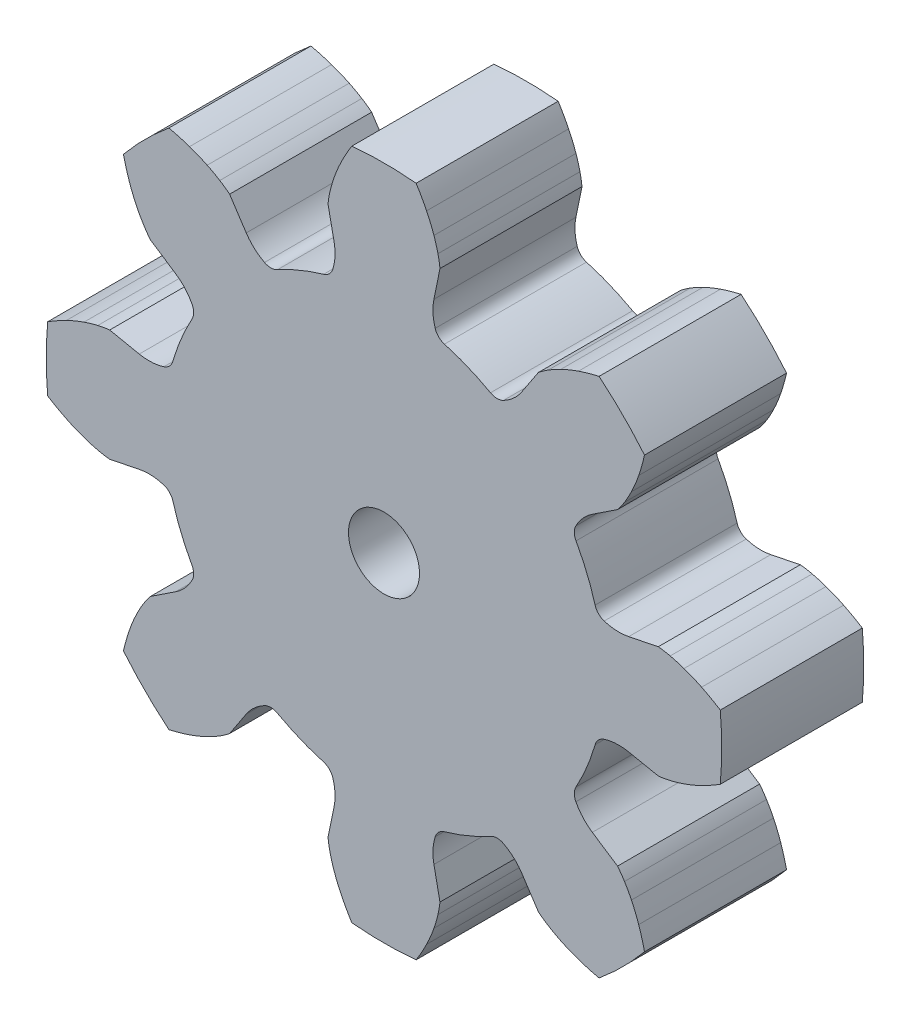
from build123d import *

# Parameters (mm, degrees)
BOSS_EXTRUDE1_DEPTH = 6.35
SKETCH2_R           = 1.5875
CUT_EXTRUDE1_DEPTH  = 23.284602263


with BuildPart() as part:
    # Model → Boss-Extrude1 (new body)
    with BuildSketch(Plane.XY):
        with BuildLine():
            Line((10.941748162, -2.232688974), (12.264436965, -2.502586677))
            ThreePointArc((12.264436965, -2.502586677), (12.531238017, -2.46596816), (12.795229484, -2.41274953))
            ThreePointArc((12.795229484, -2.41274953), (13.106430951, -2.331177744), (13.412940362, -2.233441923))
            ThreePointArc((13.412940362, -2.233441923), (13.811496383, -2.08104704), (14.200064035, -1.904734018))
            ThreePointArc((14.200064035, -1.904734018), (14.624278476, -1.682049743), (15.035831779, -1.436753888))
            ThreePointArc((15.035831779, -1.436753888), (15.104320541, 0), (15.035831779, 1.436753888))
            ThreePointArc((15.035831779, 1.436753888), (14.624278476, 1.682049743), (14.200064035, 1.904734018))
            ThreePointArc((14.200064035, 1.904734018), (13.811496383, 2.08104704), (13.412940362, 2.233441923))
            ThreePointArc((13.412940362, 2.233441923), (13.106430951, 2.331177744), (12.795229484, 2.41274953))
            ThreePointArc((12.795229484, 2.41274953), (12.531238017, 2.46596816), (12.264436965, 2.502586677))
            Line((12.264436965, 2.502586677), (10.941748216, 2.232688984))
            ThreePointArc((10.941748216, 2.232688984), (10.38941583, 2.191161038), (9.844221433, 2.288929667))
            ThreePointArc((9.844221433, 2.288929667), (9.58984879, 2.445145019), (9.439984515, 2.703310425))
            ThreePointArc((9.439984515, 2.703310425), (9.071969901, 3.757732961), (8.586606206, 4.763547917))
            ThreePointArc((8.586606206, 4.763547917), (8.510025734, 5.052068464), (8.579433412, 5.342398017))
            ThreePointArc((8.579433412, 5.342398017), (8.895811187, 5.797041528), (9.315733837, 6.15823481))
            Line((9.315733837, 6.15823481), (10.441862555, 6.902670535))
            ThreePointArc((10.441862555, 6.902670535), (10.604626186, 7.11722057), (10.753665089, 7.341521981))
            ThreePointArc((10.753665089, 7.341521981), (10.916037793, 7.619254612), (11.063663015, 7.905099156))
            ThreePointArc((11.063663015, 7.905099156), (11.237725225, 8.294680276), (11.387811912, 8.694111232))
            ThreePointArc((11.387811912, 8.694111232), (11.53031526, 9.1515377), (11.647877028, 9.616000194))
            ThreePointArc((11.647877028, 9.616000194), (10.68036748, 10.68036748), (9.616000194, 11.647877028))
            ThreePointArc((9.616000194, 11.647877028), (9.1515377, 11.53031526), (8.694111232, 11.387811912))
            ThreePointArc((8.694111232, 11.387811912), (8.294680276, 11.237725225), (7.905099156, 11.063663015))
            ThreePointArc((7.905099156, 11.063663015), (7.619254612, 10.916037793), (7.341521981, 10.753665089))
            ThreePointArc((7.341521981, 10.753665089), (7.11722057, 10.604626186), (6.902670535, 10.441862555))
            Line((6.902670535, 10.441862555), (6.15823484, 9.315733882))
            ThreePointArc((6.15823484, 9.315733882), (5.797041557, 8.895811214), (5.342398042, 8.57943342))
            ThreePointArc((5.342398042, 8.57943342), (5.052068486, 8.510025734), (4.763547932, 8.586606198))
            ThreePointArc((4.763547932, 8.586606198), (3.757732977, 9.071969895), (2.703310441, 9.43998451))
            ThreePointArc((2.703310441, 9.43998451), (2.445145035, 9.589848775), (2.288929678, 9.84422141))
            ThreePointArc((2.288929678, 9.84422141), (2.191161039, 10.38941579), (2.232688974, 10.941748162))
            Line((2.232688974, 10.941748162), (2.502586677, 12.264436965))
            ThreePointArc((2.502586677, 12.264436965), (2.46596816, 12.531238017), (2.41274953, 12.795229484))
            ThreePointArc((2.41274953, 12.795229484), (2.331177744, 13.106430951), (2.233441923, 13.412940362))
            ThreePointArc((2.233441923, 13.412940362), (2.08104704, 13.811496383), (1.904734018, 14.200064035))
            ThreePointArc((1.904734018, 14.200064035), (1.682049743, 14.624278476), (1.436753888, 15.035831779))
            ThreePointArc((1.436753888, 15.035831779), (0, 15.104320541), (-1.436753888, 15.035831779))
            ThreePointArc((-1.436753888, 15.035831779), (-1.682049743, 14.624278476), (-1.904734018, 14.200064035))
            ThreePointArc((-1.904734018, 14.200064035), (-2.08104704, 13.811496383), (-2.233441923, 13.412940362))
            ThreePointArc((-2.233441923, 13.412940362), (-2.331177744, 13.106430951), (-2.41274953, 12.795229484))
            ThreePointArc((-2.41274953, 12.795229484), (-2.46596816, 12.531238017), (-2.502586677, 12.264436965))
            Line((-2.502586677, 12.264436965), (-2.232688984, 10.941748216))
            ThreePointArc((-2.232688984, 10.941748216), (-2.191161038, 10.38941583), (-2.288929667, 9.844221433))
            ThreePointArc((-2.288929667, 9.844221433), (-2.445145019, 9.58984879), (-2.703310425, 9.439984515))
            ThreePointArc((-2.703310425, 9.439984515), (-3.757732961, 9.071969901), (-4.763547917, 8.586606206))
            ThreePointArc((-4.763547917, 8.586606206), (-5.052068464, 8.510025734), (-5.342398017, 8.579433412))
            ThreePointArc((-5.342398017, 8.579433412), (-5.797041528, 8.895811187), (-6.15823481, 9.315733837))
            Line((-6.15823481, 9.315733837), (-6.902670535, 10.441862555))
            ThreePointArc((-6.902670535, 10.441862555), (-7.11722057, 10.604626186), (-7.341521981, 10.753665089))
            ThreePointArc((-7.341521981, 10.753665089), (-7.619254612, 10.916037793), (-7.905099156, 11.063663015))
            ThreePointArc((-7.905099156, 11.063663015), (-8.294680276, 11.237725225), (-8.694111232, 11.387811912))
            ThreePointArc((-8.694111232, 11.387811912), (-9.1515377, 11.53031526), (-9.616000194, 11.647877028))
            ThreePointArc((-9.616000194, 11.647877028), (-10.68036748, 10.68036748), (-11.647877028, 9.616000194))
            ThreePointArc((-11.647877028, 9.616000194), (-11.53031526, 9.1515377), (-11.387811912, 8.694111232))
            ThreePointArc((-11.387811912, 8.694111232), (-11.237725225, 8.294680276), (-11.063663015, 7.905099156))
            ThreePointArc((-11.063663015, 7.905099156), (-10.916037793, 7.619254612), (-10.753665089, 7.341521981))
            ThreePointArc((-10.753665089, 7.341521981), (-10.604626186, 7.11722057), (-10.441862555, 6.902670535))
            Line((-10.441862555, 6.902670535), (-9.315733882, 6.15823484))
            ThreePointArc((-9.315733882, 6.15823484), (-8.895811214, 5.797041557), (-8.57943342, 5.342398042))
            ThreePointArc((-8.57943342, 5.342398042), (-8.510025734, 5.052068486), (-8.586606198, 4.763547932))
            ThreePointArc((-8.586606198, 4.763547932), (-9.071969895, 3.757732977), (-9.43998451, 2.703310441))
            ThreePointArc((-9.43998451, 2.703310441), (-9.589848775, 2.445145035), (-9.84422141, 2.288929678))
            ThreePointArc((-9.84422141, 2.288929678), (-10.38941579, 2.191161039), (-10.941748162, 2.232688974))
            Line((-10.941748162, 2.232688974), (-12.264436965, 2.502586677))
            ThreePointArc((-12.264436965, 2.502586677), (-12.531238017, 2.46596816), (-12.795229484, 2.41274953))
            ThreePointArc((-12.795229484, 2.41274953), (-13.106430951, 2.331177744), (-13.412940362, 2.233441923))
            ThreePointArc((-13.412940362, 2.233441923), (-13.811496383, 2.08104704), (-14.200064035, 1.904734018))
            ThreePointArc((-14.200064035, 1.904734018), (-14.624278476, 1.682049743), (-15.035831779, 1.436753888))
            ThreePointArc((-15.035831779, 1.436753888), (-15.104320541, 0), (-15.035831779, -1.436753888))
            ThreePointArc((-15.035831779, -1.436753888), (-14.624278476, -1.682049743), (-14.200064035, -1.904734018))
            ThreePointArc((-14.200064035, -1.904734018), (-13.811496383, -2.08104704), (-13.412940362, -2.233441923))
            ThreePointArc((-13.412940362, -2.233441923), (-13.106430951, -2.331177744), (-12.795229484, -2.41274953))
            ThreePointArc((-12.795229484, -2.41274953), (-12.531238017, -2.46596816), (-12.264436965, -2.502586677))
            Line((-12.264436965, -2.502586677), (-10.941748216, -2.232688984))
            ThreePointArc((-10.941748216, -2.232688984), (-10.38941583, -2.191161038), (-9.844221433, -2.288929667))
            ThreePointArc((-9.844221433, -2.288929667), (-9.58984879, -2.445145019), (-9.439984515, -2.703310425))
            ThreePointArc((-9.439984515, -2.703310425), (-9.071969901, -3.757732961), (-8.586606206, -4.763547917))
            ThreePointArc((-8.586606206, -4.763547917), (-8.510025734, -5.052068464), (-8.579433412, -5.342398017))
            ThreePointArc((-8.579433412, -5.342398017), (-8.895811187, -5.797041528), (-9.315733837, -6.15823481))
            Line((-9.315733837, -6.15823481), (-10.441862555, -6.902670535))
            ThreePointArc((-10.441862555, -6.902670535), (-10.604626186, -7.11722057), (-10.753665089, -7.341521981))
            ThreePointArc((-10.753665089, -7.341521981), (-10.916037793, -7.619254612), (-11.063663015, -7.905099156))
            ThreePointArc((-11.063663015, -7.905099156), (-11.237725225, -8.294680276), (-11.387811912, -8.694111232))
            ThreePointArc((-11.387811912, -8.694111232), (-11.53031526, -9.1515377), (-11.647877028, -9.616000194))
            ThreePointArc((-11.647877028, -9.616000194), (-10.68036748, -10.68036748), (-9.616000194, -11.647877028))
            ThreePointArc((-9.616000194, -11.647877028), (-9.1515377, -11.53031526), (-8.694111232, -11.387811912))
            ThreePointArc((-8.694111232, -11.387811912), (-8.294680276, -11.237725225), (-7.905099156, -11.063663015))
            ThreePointArc((-7.905099156, -11.063663015), (-7.619254612, -10.916037793), (-7.341521981, -10.753665089))
            ThreePointArc((-7.341521981, -10.753665089), (-7.11722057, -10.604626186), (-6.902670535, -10.441862555))
            Line((-6.902670535, -10.441862555), (-6.15823484, -9.315733882))
            ThreePointArc((-6.15823484, -9.315733882), (-5.797041557, -8.895811214), (-5.342398042, -8.57943342))
            ThreePointArc((-5.342398042, -8.57943342), (-5.052068486, -8.510025734), (-4.763547932, -8.586606198))
            ThreePointArc((-4.763547932, -8.586606198), (-3.757732977, -9.071969895), (-2.703310441, -9.43998451))
            ThreePointArc((-2.703310441, -9.43998451), (-2.445145035, -9.589848775), (-2.288929678, -9.84422141))
            ThreePointArc((-2.288929678, -9.84422141), (-2.191161039, -10.38941579), (-2.232688974, -10.941748162))
            Line((-2.232688974, -10.941748162), (-2.502586677, -12.264436965))
            ThreePointArc((-2.502586677, -12.264436965), (-2.46596816, -12.531238017), (-2.41274953, -12.795229484))
            ThreePointArc((-2.41274953, -12.795229484), (-2.331177744, -13.106430951), (-2.233441923, -13.412940362))
            ThreePointArc((-2.233441923, -13.412940362), (-2.08104704, -13.811496383), (-1.904734018, -14.200064035))
            ThreePointArc((-1.904734018, -14.200064035), (-1.682049743, -14.624278476), (-1.436753888, -15.035831779))
            ThreePointArc((-1.436753888, -15.035831779), (0, -15.104320541), (1.436753888, -15.035831779))
            ThreePointArc((1.436753888, -15.035831779), (1.682049743, -14.624278476), (1.904734018, -14.200064035))
            ThreePointArc((1.904734018, -14.200064035), (2.08104704, -13.811496383), (2.233441923, -13.412940362))
            ThreePointArc((2.233441923, -13.412940362), (2.331177744, -13.106430951), (2.41274953, -12.795229484))
            ThreePointArc((2.41274953, -12.795229484), (2.46596816, -12.531238017), (2.502586677, -12.264436965))
            Line((2.502586677, -12.264436965), (2.232688984, -10.941748216))
            ThreePointArc((2.232688984, -10.941748216), (2.191161038, -10.38941583), (2.288929667, -9.844221433))
            ThreePointArc((2.288929667, -9.844221433), (2.445145019, -9.58984879), (2.703310425, -9.439984515))
            ThreePointArc((2.703310425, -9.439984515), (3.757732961, -9.071969901), (4.763547917, -8.586606206))
            ThreePointArc((4.763547917, -8.586606206), (5.052068464, -8.510025734), (5.342398017, -8.579433412))
            ThreePointArc((5.342398017, -8.579433412), (5.797041528, -8.895811187), (6.15823481, -9.315733837))
            Line((6.15823481, -9.315733837), (6.902670535, -10.441862555))
            ThreePointArc((6.902670535, -10.441862555), (7.11722057, -10.604626186), (7.341521981, -10.753665089))
            ThreePointArc((7.341521981, -10.753665089), (7.619254612, -10.916037793), (7.905099156, -11.063663015))
            ThreePointArc((7.905099156, -11.063663015), (8.294680276, -11.237725225), (8.694111232, -11.387811912))
            ThreePointArc((8.694111232, -11.387811912), (9.1515377, -11.53031526), (9.616000194, -11.647877028))
            ThreePointArc((9.616000194, -11.647877028), (10.68036748, -10.68036748), (11.647877028, -9.616000194))
            ThreePointArc((11.647877028, -9.616000194), (11.53031526, -9.1515377), (11.387811912, -8.694111232))
            ThreePointArc((11.387811912, -8.694111232), (11.237725225, -8.294680276), (11.063663015, -7.905099156))
            ThreePointArc((11.063663015, -7.905099156), (10.916037793, -7.619254612), (10.753665089, -7.341521981))
            ThreePointArc((10.753665089, -7.341521981), (10.604626186, -7.11722057), (10.441862555, -6.902670535))
            Line((10.441862555, -6.902670535), (9.315733882, -6.15823484))
            ThreePointArc((9.315733882, -6.15823484), (8.895811214, -5.797041557), (8.57943342, -5.342398042))
            ThreePointArc((8.57943342, -5.342398042), (8.510025734, -5.052068486), (8.586606198, -4.763547932))
            ThreePointArc((8.586606198, -4.763547932), (8.843599005, -4.267546312), (9.071969898, -3.757732969))
            ThreePointArc((9.071969898, -3.757732969), (9.270979761, -3.235757898), (9.43998451, -2.703310441))
            ThreePointArc((9.43998451, -2.703310441), (9.589848775, -2.445145035), (9.84422141, -2.288929678))
            ThreePointArc((9.84422141, -2.288929678), (10.38941579, -2.191161039), (10.941748162, -2.232688974))
        make_face()
    extrude(amount=BOSS_EXTRUDE1_DEPTH)

    # Sketch2 → Cut-Extrude1 (cut, through all)
    with BuildSketch(Plane.XY.offset(6.35)):
        Circle(SKETCH2_R)
    extrude(amount=-CUT_EXTRUDE1_DEPTH, mode=Mode.SUBTRACT)


solid = part.part
